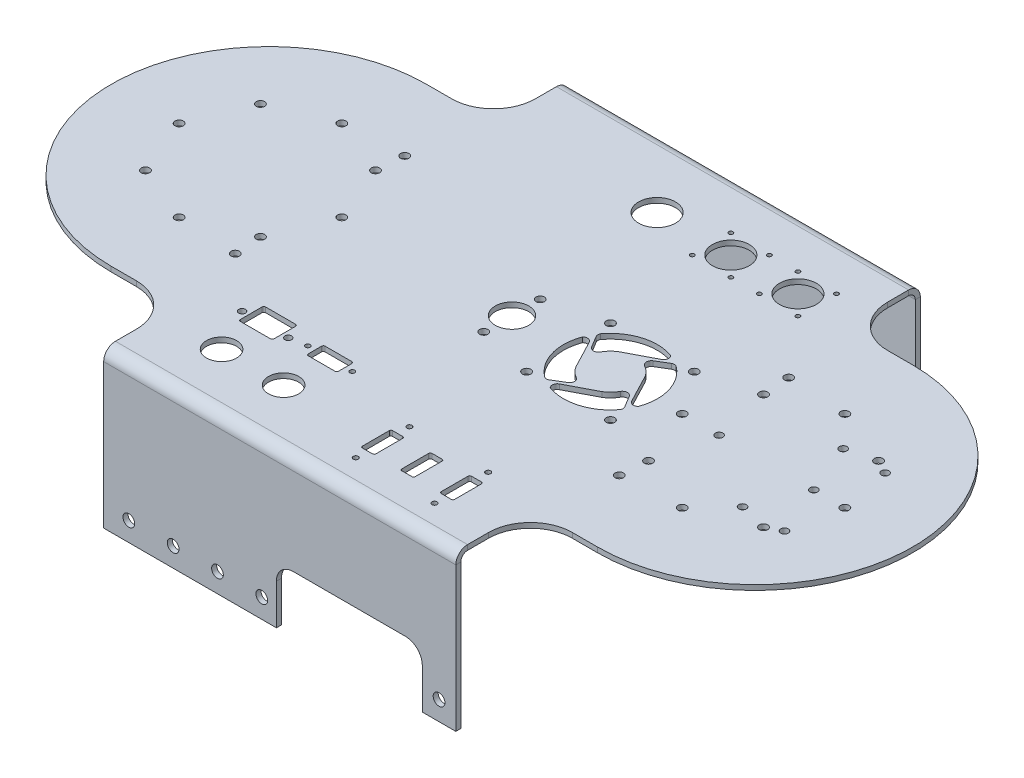
from build123d import *

# Parameters (mm, degrees)
SKETCH1_W                      = 210
SKETCH1_H                      = 277
BOSS_EXTRUDE1_DEPTH            = 3
EDGE_FLANGE1_STRIP_W           = 20
EDGE_FLANGE1_STRIP_H           = 3
EDGE_FLANGE1_STRIP_CUT_DEPTH   = 210
EDGE_FLANGE1_STRIP_2_W         = 20
EDGE_FLANGE1_STRIP_2_H         = 3
EDGE_FLANGE1_STRIP_CUT_2_DEPTH = 210
EDGE_FLANGE1_DEPTH             = 210
EDGE_FLANGE1_BEND_DEPTH        = 210
BOSS_EXTRUDE2_DEPTH            = 3
FILLET1_R                      = 25
SKETCH13_R                     = 2.25
CUT_EXTRUDE1_DEPTH             = 20
SKETCH17_R                     = 2.5
CUT_EXTRUDE3_DEPTH             = 10
SKETCH18_W                     = 50
SKETCH18_H                     = 75
CUT_EXTRUDE4_DEPTH             = 10
FILLET2_R                      = 10
SKETCH19_W                     = 87
SKETCH19_H                     = 56.371338111
CUT_EXTRUDE5_DEPTH             = 236
FILLET3_R                      = 10
SKETCH20_R                     = 3.5
CUT_EXTRUDE6_DEPTH             = 10
SKETCH21_R                     = 3.5
CUT_EXTRUDE7_DEPTH             = 10
SKETCH23_W                     = 8
SKETCH23_H                     = 18
CUT_EXTRUDE8_DEPTH             = 10
FILLET4_R                      = 1
SKETCH24_R                     = 11
CUT_EXTRUDE9_DEPTH             = 10
SKETCH25_R                     = 11
CUT_EXTRUDE10_DEPTH            = 10
SKETCH26_R                     = 9
CUT_EXTRUDE11_DEPTH            = 10
SKETCH27_R                     = 10
CUT_EXTRUDE12_DEPTH            = 10
SKETCH28_W                     = 18
SKETCH28_H                     = 10
SKETCH28_W_2                   = 20
SKETCH28_H_2                   = 15
CUT_EXTRUDE13_DEPTH            = 10
FILLET5_R                      = 1
CUT_EXTRUDE14_DEPTH            = 10
SKETCH30_R                     = 2.5
CUT_EXTRUDE15_DEPTH            = 10
SKETCH32_R                     = 1.25
CUT_EXTRUDE16_DEPTH            = 10
SKETCH33_R                     = 1.5
CUT_EXTRUDE17_DEPTH            = 10
SKETCH34_R                     = 2
SKETCH34_R_2                   = 1.4
SKETCH34_R_3                   = 2.471454149
SKETCH34_R_4                   = 2.490322522
CUT_EXTRUDE18_DEPTH            = 10
SKETCH35_R                     = 2.25
CUT_EXTRUDE19_DEPTH            = 10


# Sheet-metal steps are written as plain solids
with BuildPart() as part:
    # Sketch1 → Boss-Extrude1 (new body)
    with BuildSketch(Plane(origin=(0, 0, 0), x_dir=(1, 0, 0), z_dir=(0, 1, 0))):
        Rectangle(SKETCH1_W, SKETCH1_H)
    extrude(amount=BOSS_EXTRUDE1_DEPTH)

    # Edge-Flange1 strip (across the edge) → Edge-Flange1 strip cut (cut)
    with BuildSketch(Plane(origin=(-105, 0, -138.5), x_dir=(0, 0, 1), z_dir=(1, 0, 0))):
        with Locations((-3, -1.5)):
            Rectangle(EDGE_FLANGE1_STRIP_W, EDGE_FLANGE1_STRIP_H)
    extrude(amount=EDGE_FLANGE1_STRIP_CUT_DEPTH, mode=Mode.SUBTRACT)

    # Edge-Flange1 strip 2 (across the edge) → Edge-Flange1 strip cut 2 (cut)
    with BuildSketch(Plane(origin=(105, 0, 138.5), x_dir=(0, 0, -1), z_dir=(-1, 0, 0))):
        with Locations((-3, -1.5)):
            Rectangle(EDGE_FLANGE1_STRIP_2_W, EDGE_FLANGE1_STRIP_2_H)
    extrude(amount=EDGE_FLANGE1_STRIP_CUT_2_DEPTH, mode=Mode.SUBTRACT)

    # Edge-Flange1 section (across the edge) → Edge-Flange1 (add)
    with BuildSketch(Plane(origin=(-105, 0, -138.5), x_dir=(0, 0, 1), z_dir=(1, 0, 0))):
        with BuildLine():
            Line((0, 4), (0, 90))
            Line((0, 90), (3, 90))
            Line((3, 90), (3, 4))
            ThreePointArc((3, 4), (4.171572875, 1.171572875), (7, 0))
            Line((7, 0), (7, -3))
            ThreePointArc((7, -3), (2.050252532, -0.949747468), (0, 4))
        make_face()
    extrude(amount=EDGE_FLANGE1_DEPTH)

    # Edge-Flange1 section 2 (across the edge) → Edge-Flange1 bend (add)
    with BuildSketch(Plane(origin=(105, 0, 138.5), x_dir=(0, 0, -1), z_dir=(-1, 0, 0))):
        with BuildLine():
            Line((0, 4), (0, 90))
            Line((0, 90), (3, 90))
            Line((3, 90), (3, 4))
            ThreePointArc((3, 4), (4.171572875, 1.171572875), (7, 0))
            Line((7, 0), (7, -3))
            ThreePointArc((7, -3), (2.050252532, -0.949747468), (0, 4))
        make_face()
    extrude(amount=EDGE_FLANGE1_BEND_DEPTH)

    # Sketch12 → Boss-Extrude2 (add)
    with BuildSketch(Plane(origin=(0, 3, 0), x_dir=(1, 0, 0), z_dir=(0, 1, 0))):
        with BuildLine():
            Line((-105, 94), (-145, 94))
            ThreePointArc((-145, 94), (-239, 0), (-145, -94))
            Line((-145, -94), (-105, -94))
            Line((-105, -94), (-105, 94))
        make_face()
        with BuildLine():
            Line((105, -94), (145, -94))
            ThreePointArc((145, -94), (239, 0), (145, 94))
            Line((145, 94), (105, 94))
            Line((105, 94), (105, -94))
        make_face()
    extrude(amount=-BOSS_EXTRUDE2_DEPTH)

    # Fillet1
    fillet1_edges = [part.edges().sort_by_distance(p)[0] for p in [
        (-105, 1.5, 94),
        (-105, 1.5, -94),
        (105, 1.5, -94),
        (105, 1.5, 94),
    ]]
    fillet(fillet1_edges, radius=FILLET1_R)

    # Sketch13 → Cut-Extrude1 (cut)
    with BuildSketch(Plane(origin=(0, 3, 0), x_dir=(1, 0, 0), z_dir=(0, 1, 0))):
        with Locations(Location((180, 0, 0), (0, 0, 270))):
            Circle(SKETCH13_R)
        with Locations(Location((167.5, 30, 0), (0, 0, 270))):
            Circle(SKETCH13_R)
        with Locations(Location((192.5, 30, 0), (0, 0, 270))):
            Circle(SKETCH13_R)
        with Locations(Location((192.5, -30, 0), (0, 0, 270))):
            Circle(SKETCH13_R)
        with Locations(Location((167.5, -30, 0), (0, 0, 270))):
            Circle(SKETCH13_R)
    extrude(amount=-CUT_EXTRUDE1_DEPTH, mode=Mode.SUBTRACT)

    # Sketch17 → Cut-Extrude3 (cut)
    with BuildSketch(Plane(origin=(0, 3, 0), x_dir=(1, 0, 0), z_dir=(0, 1, 0))):
        with Locations(Location((184.294678888, 34.294678888, 0), (0, 0, 270))):
            Circle(SKETCH17_R)
        with Locations(Location((150, 48.5, 0), (0, 0, 270))):
            Circle(SKETCH17_R)
        with Locations(Location((115.705321112, 34.294678888, 0), (0, 0, 270))):
            Circle(SKETCH17_R)
        with Locations(Location((114.500000561, 50.5, 0), (0, 0, 270))):
            Circle(SKETCH17_R)
        with Locations(Location((101.5, 0, 0), (0, 0, 270))):
            Circle(SKETCH17_R)
        with Locations(Location((115.705321112, -34.294678888, 0), (0, 0, 270))):
            Circle(SKETCH17_R)
        with Locations(Location((114.500000561, -50.5, 0), (0, 0, 270))):
            Circle(SKETCH17_R)
        with Locations(Location((150, -48.5, 0), (0, 0, 270))):
            Circle(SKETCH17_R)
        with Locations(Location((184.294678888, -34.294678888, 0), (0, 0, 270))):
            Circle(SKETCH17_R)
        with Locations(Location((198.5, 0, 0), (0, 0, 270))):
            Circle(SKETCH17_R)
        with Locations(Location((-198.5, 0, 0), (0, 0, 90))):
            Circle(SKETCH17_R)
        with Locations(Location((-184.294678888, -34.294678888, 0), (0, 0, 90))):
            Circle(SKETCH17_R)
        with Locations(Location((-150, -48.5, 0), (0, 0, 90))):
            Circle(SKETCH17_R)
        with Locations(Location((-114.500000561, -50.5, 0), (0, 0, 90))):
            Circle(SKETCH17_R)
        with Locations(Location((-115.705321112, -34.294678888, 0), (0, 0, 90))):
            Circle(SKETCH17_R)
        with Locations(Location((-101.5, 0, 0), (0, 0, 90))):
            Circle(SKETCH17_R)
        with Locations(Location((-114.500000561, 50.5, 0), (0, 0, 90))):
            Circle(SKETCH17_R)
        with Locations(Location((-115.705321112, 34.294678888, 0), (0, 0, 90))):
            Circle(SKETCH17_R)
        with Locations(Location((-150, 48.5, 0), (0, 0, 90))):
            Circle(SKETCH17_R)
        with Locations(Location((-184.294678888, 34.294678888, 0), (0, 0, 90))):
            Circle(SKETCH17_R)
    extrude(amount=-CUT_EXTRUDE3_DEPTH, mode=Mode.SUBTRACT)

    # Sketch18 → Cut-Extrude4 (cut)
    with BuildSketch(Plane(origin=(0, 0, -138.5), x_dir=(-1, 0, 0), z_dir=(0, 0, -1))):
        with Locations((55, -52.5)):
            Rectangle(SKETCH18_W, SKETCH18_H)
    extrude(amount=-CUT_EXTRUDE4_DEPTH, mode=Mode.SUBTRACT)

    # Fillet2
    fillet2_edges = [part.edges().sort_by_distance(p)[0] for p in [
        (-30, -15, -137),
        (-80, -15, -137),
    ]]
    fillet(fillet2_edges, radius=FILLET2_R)

    # Sketch19 → Cut-Extrude5 (cut)
    with BuildSketch(Plane.XY.offset(138.5)):
        with Locations((41.5, -84.097214153)):
            Rectangle(SKETCH19_W, SKETCH19_H)
    extrude(amount=-CUT_EXTRUDE5_DEPTH, mode=Mode.SUBTRACT)

    # Fillet3
    fillet3_edges = [part.edges().sort_by_distance(p)[0] for p in [
        (-2, -55.911545097, 137),
        (85, -55.911545097, 137),
    ]]
    fillet(fillet3_edges, radius=FILLET3_R)

    # Sketch20 → Cut-Extrude6 (cut)
    with BuildSketch(Plane.XY.offset(138.5)):
        with Locations((-90, -78.5)):
            Circle(SKETCH20_R)
        with Locations((-63.571428571, -78.5)):
            Circle(SKETCH20_R)
        with Locations((-37.142857143, -78.5)):
            Circle(SKETCH20_R)
        with Locations((-10.714285714, -78.5)):
            Circle(SKETCH20_R)
        with Locations((95, -78.5)):
            Circle(SKETCH20_R)
    extrude(amount=-CUT_EXTRUDE6_DEPTH, mode=Mode.SUBTRACT)

    # Sketch21 → Cut-Extrude7 (cut)
    with BuildSketch(Plane(origin=(0, 0, -138.5), x_dir=(-1, 0, 0), z_dir=(0, 0, -1))):
        with Locations(Location((-93, -78.5, 0), (0, 0, 90))):
            Circle(SKETCH21_R)
        with Locations(Location((-55.8, -78.5, 0), (0, 0, 90))):
            Circle(SKETCH21_R)
        with Locations(Location((-18.6, -78.5, 0), (0, 0, 90))):
            Circle(SKETCH21_R)
        with Locations(Location((18.6, -78.5, 0), (0, 0, 90))):
            Circle(SKETCH21_R)
        with Locations(Location((93, -78.5, 0), (0, 0, 90))):
            Circle(SKETCH21_R)
    extrude(amount=-CUT_EXTRUDE7_DEPTH, mode=Mode.SUBTRACT)

    # Sketch23 → Cut-Extrude8 (cut)
    with BuildSketch(Plane(origin=(0, 3, 0), x_dir=(1, 0, 0), z_dir=(0, 1, 0))):
        with Locations((26.8, -104)):
            Rectangle(SKETCH23_W, SKETCH23_H)
        with Locations((50.3, -104)):
            Rectangle(SKETCH23_W, SKETCH23_H)
        with Locations((73.8, -104)):
            Rectangle(SKETCH23_W, SKETCH23_H)
    extrude(amount=-CUT_EXTRUDE8_DEPTH, mode=Mode.SUBTRACT)

    # Fillet4
    fillet4_edges = [part.edges().sort_by_distance(p)[0] for p in [
        (30.8, 1.5, 95),
        (30.8, 1.5, 113),
        (22.8, 1.5, 113),
        (22.8, 1.5, 95),
        (54.3, 1.5, 95),
        (54.3, 1.5, 113),
        (46.3, 1.5, 113),
        (46.3, 1.5, 95),
        (77.8, 1.5, 95),
        (77.8, 1.5, 113),
        (69.8, 1.5, 113),
        (69.8, 1.5, 95),
    ]]
    fillet(fillet4_edges, radius=FILLET4_R)

    # Sketch24 → Cut-Extrude9 (cut)
    with BuildSketch(Plane(origin=(0, 3, 0), x_dir=(1, 0, 0), z_dir=(0, 1, 0))):
        with Locations(Location((-10, 96.5, 0), (0, 0, 270))):
            Circle(SKETCH24_R)
    extrude(amount=-CUT_EXTRUDE9_DEPTH, mode=Mode.SUBTRACT)

    # Sketch25 → Cut-Extrude10 (cut)
    with BuildSketch(Plane(origin=(0, 3, 0), x_dir=(1, 0, 0), z_dir=(0, 1, 0))):
        with Locations(Location((74, 96.5, 0), (0, 0, 270))):
            Circle(SKETCH25_R)
        with Locations(Location((34, 96.5, 0), (0, 0, 270))):
            Circle(SKETCH25_R)
    extrude(amount=-CUT_EXTRUDE10_DEPTH, mode=Mode.SUBTRACT)

    # Sketch26 → Cut-Extrude11 (cut)
    with BuildSketch(Plane(origin=(0, 3, 0), x_dir=(1, 0, 0), z_dir=(0, 1, 0))):
        with Locations(Location((-69.2, -104, 0), (0, 0, 270))):
            Circle(SKETCH26_R)
        with Locations(Location((-32.2, -104, 0), (0, 0, 270))):
            Circle(SKETCH26_R)
    extrude(amount=-CUT_EXTRUDE11_DEPTH, mode=Mode.SUBTRACT)

    # Sketch27 → Cut-Extrude12 (cut)
    with BuildSketch(Plane(origin=(0, 3, 0), x_dir=(1, 0, 0), z_dir=(0, 1, 0))):
        with Locations(Location((0, 0, 0), (0, 0, 270))):
            Circle(SKETCH27_R)
    extrude(amount=-CUT_EXTRUDE12_DEPTH, mode=Mode.SUBTRACT)

    # Sketch28 → Cut-Extrude13 (cut)
    with BuildSketch(Plane(origin=(0, 3, 0), x_dir=(1, 0, 0), z_dir=(0, 1, 0))):
        with Locations((-32, -76.5)):
            Rectangle(SKETCH28_W, SKETCH28_H)
        with Locations((-69, -76.5)):
            Rectangle(SKETCH28_W_2, SKETCH28_H_2)
    extrude(amount=-CUT_EXTRUDE13_DEPTH, mode=Mode.SUBTRACT)

    # Fillet5
    fillet5_edges = [part.edges().sort_by_distance(p)[0] for p in [
        (-41, 1.5, 81.5),
        (-41, 1.5, 71.5),
        (-23, 1.5, 71.5),
        (-23, 1.5, 81.5),
        (-79, 1.5, 84),
        (-79, 1.5, 69),
        (-59, 1.5, 69),
        (-59, 1.5, 84),
    ]]
    fillet(fillet5_edges, radius=FILLET5_R)

    # Sketch29 → Cut-Extrude14 (cut)
    with BuildSketch(Plane(origin=(0, 3, 0), x_dir=(1, 0, 0), z_dir=(0, 1, 0))):
        with BuildLine():
            Line((44.348561624, -22.05491203), (51.187219474, -17.936792431))
            ThreePointArc((51.187219474, -17.936792431), (52.639013932, -15.306991315), (51.083552256, -12.737146955))
            ThreePointArc((51.083552256, -12.737146955), (47.919558695, -10.413833933), (45.46667063, -7.349200383))
            Line((45.46667063, -7.349200383), (36.777815349, 9.286357832))
            ThreePointArc((36.777815349, 9.286357832), (34.579459006, 10.861877176), (32.006589676, 10.027985558))
            ThreePointArc((32.006589676, 10.027985558), (31.485361518, -7.638774585), (41.649770771, -22.098058014))
            ThreePointArc((41.649770771, -22.098058014), (43.004974859, -22.43981811), (44.348561624, -22.05491203))
        make_face()
        with BuildLine():
            Line((50.542986292, 13.247670427), (67.178544507, 21.936525709))
            ThreePointArc((67.178544507, 21.936525709), (68.754063851, 24.134882052), (67.920172233, 26.707751381))
            ThreePointArc((67.920172233, 26.707751381), (50.25341209, 27.22897954), (35.794128661, 17.064570287))
            ThreePointArc((35.794128661, 17.064570287), (35.452368565, 15.709366199), (35.837274645, 14.365779434))
            Line((35.837274645, 14.365779434), (39.955394244, 7.527121584))
            ThreePointArc((39.955394244, 7.527121584), (42.58519536, 6.075327126), (45.15503972, 7.630788802))
            ThreePointArc((45.15503972, 7.630788802), (47.478352742, 10.794782363), (50.542986292, 13.247670427))
        make_face()
        with BuildLine():
            Line((71.139857102, 8.171354766), (79.828712384, -8.464203449))
            ThreePointArc((79.828712384, -8.464203449), (82.027068727, -10.039722794), (84.599938056, -9.205831176))
            ThreePointArc((84.599938056, -9.205831176), (85.121166215, 8.460928967), (74.956756962, 22.920212397))
            ThreePointArc((74.956756962, 22.920212397), (73.601552874, 23.261972492), (72.257966109, 22.877066412))
            Line((72.257966109, 22.877066412), (65.419308259, 18.758946814))
            ThreePointArc((65.419308259, 18.758946814), (63.967513801, 16.129145698), (65.522975477, 13.559301337))
            ThreePointArc((65.522975477, 13.559301337), (68.686969038, 11.235988316), (71.139857102, 8.171354766))
        make_face()
        with BuildLine():
            Line((66.063541441, -12.425516045), (49.427983226, -21.114371326))
            ThreePointArc((49.427983226, -21.114371326), (47.852463881, -23.312727669), (48.686355499, -25.885596999))
            ThreePointArc((48.686355499, -25.885596999), (66.353115643, -26.406825157), (80.812399072, -16.242415905))
            ThreePointArc((80.812399072, -16.242415905), (81.154159167, -14.887211816), (80.769253087, -13.543625051))
            Line((80.769253087, -13.543625051), (76.651133489, -6.704967201))
            ThreePointArc((76.651133489, -6.704967201), (74.021332373, -5.253172743), (71.451488013, -6.808634419))
            ThreePointArc((71.451488013, -6.808634419), (69.128174991, -9.97262798), (66.063541441, -12.425516045))
        make_face()
    extrude(amount=-CUT_EXTRUDE14_DEPTH, mode=Mode.SUBTRACT)

    # Sketch30 → Cut-Extrude15 (cut)
    with BuildSketch(Plane(origin=(0, 3, 0), x_dir=(1, 0, 0), z_dir=(0, 1, 0))):
        with Locations(Location((33.303263866, 25.411077191, 0), (0, 0, 270))):
            Circle(SKETCH30_R)
        with Locations(Location((83.303263866, 25.411077191, 0), (0, 0, 270))):
            Circle(SKETCH30_R)
        with Locations(Location((33.303263866, -24.588922809, 0), (0, 0, 270))):
            Circle(SKETCH30_R)
        with Locations(Location((83.303263866, -24.588922809, 0), (0, 0, 270))):
            Circle(SKETCH30_R)
    extrude(amount=-CUT_EXTRUDE15_DEPTH, mode=Mode.SUBTRACT)

    # Sketch32 → Cut-Extrude16 (cut)
    with BuildSketch(Plane(origin=(0, 3, 0), x_dir=(1, 0, 0), z_dir=(0, 1, 0))):
        with Locations(Location((22.5, 108, 0), (0, 0, 270))):
            Circle(SKETCH32_R)
        with Locations(Location((45.5, 108, 0), (0, 0, 270))):
            Circle(SKETCH32_R)
        with Locations(Location((45.5, 85, 0), (0, 0, 270))):
            Circle(SKETCH32_R)
        with Locations(Location((22.5, 85, 0), (0, 0, 270))):
            Circle(SKETCH32_R)
        with Locations(Location((85.5, 85, 0), (0, 0, 90))):
            Circle(SKETCH32_R)
        with Locations(Location((62.5, 85, 0), (0, 0, 90))):
            Circle(SKETCH32_R)
        with Locations(Location((62.5, 108, 0), (0, 0, 90))):
            Circle(SKETCH32_R)
        with Locations(Location((85.5, 108, 0), (0, 0, 90))):
            Circle(SKETCH32_R)
    extrude(amount=-CUT_EXTRUDE16_DEPTH, mode=Mode.SUBTRACT)

    # Sketch33 → Cut-Extrude17 (cut)
    with BuildSketch(Plane(origin=(0, 3, 0), x_dir=(1, 0, 0), z_dir=(0, 1, 0))):
        with Locations(Location((26.8, -88, 0), (0, 0, 270))):
            Circle(SKETCH33_R)
        with Locations(Location((73.8, -88, 0), (0, 0, 270))):
            Circle(SKETCH33_R)
        with Locations(Location((73.8, -120, 0), (0, 0, 90))):
            Circle(SKETCH33_R)
        with Locations(Location((26.8, -120, 0), (0, 0, 90))):
            Circle(SKETCH33_R)
    extrude(amount=-CUT_EXTRUDE17_DEPTH, mode=Mode.SUBTRACT)

    # Sketch34 → Cut-Extrude18 (cut)
    with BuildSketch(Plane(origin=(0, 3, 0), x_dir=(1, 0, 0), z_dir=(0, 1, 0))):
        with Locations(Location((-82.75, -78.199, 0), (0, 0, 270))):
            Circle(SKETCH34_R)
        with Locations(Location((-55.25000011, -78.199, 0), (0, 0, 270))):
            Circle(SKETCH34_R)
        with Locations(Location((-45.24999989, -76.5, 0), (0, 0, 270))):
            Circle(SKETCH34_R_2)
        with Locations(Location((-18.75, -76.5, 0), (0, 0, 270))):
            Circle(SKETCH34_R_2)
        with Locations(Location((0, 16.815911381, 0), (0, 0, 270))):
            Circle(SKETCH34_R_3)
        with Locations(Location((0, -16.815911381, 0), (0, 0, 270))):
            Circle(SKETCH34_R_4)
    extrude(amount=-CUT_EXTRUDE18_DEPTH, mode=Mode.SUBTRACT)

    # Sketch35 → Cut-Extrude19 (cut)
    with BuildSketch(Plane(origin=(0, 3, 0), x_dir=(1, 0, 0), z_dir=(0, 1, 0))):
        with Locations(Location((123.5, 0, 0), (0, 0, 270))):
            Circle(SKETCH35_R)
    extrude(amount=-CUT_EXTRUDE19_DEPTH, mode=Mode.SUBTRACT)


solid = part.part
